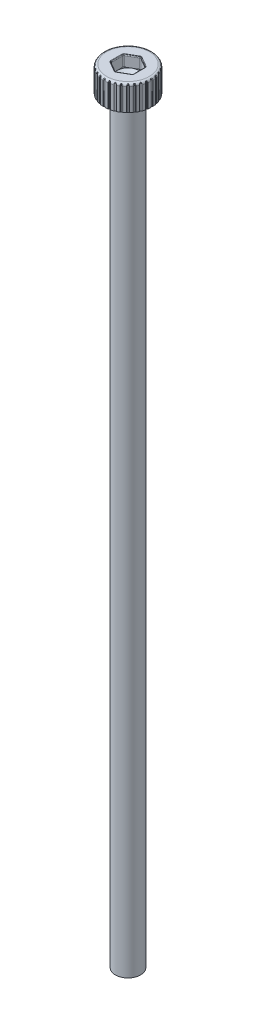
from build123d import *

# Parameters (mm, degrees)
SKETCH1_R                = 2.84
BOSS_EXTRUDE1_DEPTH      = 3
SKETCH2_R                = 1.5
BOSS_EXTRUDE2_DEPTH      = 90
CUT_EXTRUDE1_DEPTH       = 1.3
FILLET1_R                = 0.3
SKETCH5_R                = 0.075
CUT_EXTRUDE2_DEPTH       = 91.08957321
FILLET2_R                = 0.075
CIRPATTERN1_COUNT        = 32
FILLET2_OF_CIRPATTERN1_R = 0.075
CHAMFER1_SIZE            = 0.075
FILLET3_R                = 0.15
FILLET4_R                = 0.15
FILLET5_R                = 0.075


with BuildPart() as part:
    # Sketch1 → Boss-Extrude1 (new body)
    with BuildSketch(Plane(origin=(0, 0, 0), x_dir=(1, 0, 0), z_dir=(0, 1, 0))):
        Circle(SKETCH1_R)
    extrude(amount=BOSS_EXTRUDE1_DEPTH)

    # Sketch2 → Boss-Extrude2 (add)
    with BuildSketch(Plane.XZ):
        Circle(SKETCH2_R)
    extrude(amount=BOSS_EXTRUDE2_DEPTH)

    # Sketch3 → Cut-Extrude1 (cut)
    with BuildSketch(Plane(origin=(0, 3, 0), x_dir=(1, 0, 0), z_dir=(0, 1, 0))):
        Polygon((1.29, 0.744781847), (0, 1.489563695), (-1.29, 0.744781847), (-1.29, -0.744781847), (0, -1.489563695), (1.29, -0.744781847), align=None)
    extrude(amount=-CUT_EXTRUDE1_DEPTH, mode=Mode.SUBTRACT)

    # Sketch4 → Cut-Revolve1 (revolve, cut)
    with BuildSketch(Plane.XY):
        Polygon((0, 1.7), (0, 0.955218153), (1.29, 1.7), align=None)
    revolve(axis=Axis((0, 0.955218153, 0), (0, -1, 0)), mode=Mode.SUBTRACT)

    # Fillet1
    fillet1_edges = [part.edges().sort_by_distance(p)[0] for p in [
        (-2.84, 3, 0),
    ]]
    fillet(fillet1_edges, radius=FILLET1_R)

    # Sketch5 → Cut-Extrude2 (cut, through all)
    with BuildSketch(Plane.XZ):
        with Locations((0, 2.84)):
            Circle(SKETCH5_R)
    cut_extrude2 = extrude(amount=-CUT_EXTRUDE2_DEPTH, mode=Mode.SUBTRACT)

    # Fillet2
    fillet2_edges = [part.edges().sort_by_distance(p)[0] for p in [
        (0.074993462, 1.35, 2.839009683),
        (0, 2.898431349, 2.764999999),
        (-0.074993462, 1.35, 2.839009683),
    ]]
    fillet(fillet2_edges, radius=FILLET2_R)

    # CirPattern1: Cut-Extrude2 ×32 about axis
    cirpattern1_axis = Axis((0, 3, 0), (0, -1, 0))
    for i in range(1, CIRPATTERN1_COUNT):
        add(cut_extrude2.rotate(cirpattern1_axis, i * 360 / CIRPATTERN1_COUNT), mode=Mode.SUBTRACT)

    # Fillet2 of CirPattern1
    fillet2_of_cirpattern1_edges = [part.edges().sort_by_distance(p)[0] for p in [
        (-0.48031083, 1.35, 2.799089407),
        (-0.53942474, 2.898431349, 2.7118713),
        (-0.627415796, 1.35, 2.76982841),
        (-1.017157046, 1.35, 2.651601694),
        (-1.05811969, 2.898431349, 2.554526907),
        (-1.155726894, 1.35, 2.594204184),
        (-1.514914487, 1.35, 2.402214415),
        (-1.536151694, 2.898431349, 2.299013477),
        (-1.639624056, 1.35, 2.318886146),
        (-1.954454614, 1.35, 2.060511384),
        (-1.955150249, 2.898431349, 1.95515025),
        (-2.060511384, 1.35, 1.954454614),
        (-2.318886146, 1.35, 1.639624056),
        (-2.299013477, 2.898431349, 1.536151694),
        (-2.402214415, 1.35, 1.514914487),
        (-2.594204184, 1.35, 1.155726894),
        (-2.554526907, 2.898431349, 1.05811969),
        (-2.651601694, 1.35, 1.017157046),
        (-2.76982841, 1.35, 0.627415796),
        (-2.7118713, 2.898431349, 0.53942474),
        (-2.799089407, 1.35, 0.48031083),
        (-2.839009683, 1.35, 0.074993462),
        (-2.764999999, 2.898431349, 0),
        (-2.839009683, 1.35, -0.074993462),
        (-2.799089407, 1.35, -0.48031083),
        (-2.7118713, 2.898431349, -0.53942474),
        (-2.76982841, 1.35, -0.627415796),
        (-2.651601694, 1.35, -1.017157046),
        (-2.554526907, 2.898431349, -1.05811969),
        (-2.594204184, 1.35, -1.155726894),
        (-2.402214415, 1.35, -1.514914487),
        (-2.299013477, 2.898431349, -1.536151694),
        (-2.318886146, 1.35, -1.639624056),
        (-2.060511384, 1.35, -1.954454614),
        (-1.95515025, 2.898431349, -1.955150249),
        (-1.954454614, 1.35, -2.060511384),
        (-1.639624056, 1.35, -2.318886146),
        (-1.536151694, 2.898431349, -2.299013477),
        (-1.514914487, 1.35, -2.402214415),
        (-1.155726894, 1.35, -2.594204184),
        (-1.05811969, 2.898431349, -2.554526907),
        (-1.017157046, 1.35, -2.651601694),
        (-0.627415796, 1.35, -2.76982841),
        (-0.53942474, 2.898431349, -2.7118713),
        (-0.48031083, 1.35, -2.799089407),
        (-0.074993462, 1.35, -2.839009683),
        (0, 2.898431349, -2.764999999),
        (0.074993462, 1.35, -2.839009683),
        (0.48031083, 1.35, -2.799089407),
        (0.53942474, 2.898431349, -2.7118713),
        (0.627415796, 1.35, -2.76982841),
        (1.017157046, 1.35, -2.651601694),
        (1.05811969, 2.898431349, -2.554526907),
        (1.155726894, 1.35, -2.594204184),
        (1.514914487, 1.35, -2.402214415),
        (1.536151694, 2.898431349, -2.299013477),
        (1.639624056, 1.35, -2.318886146),
        (1.954454614, 1.35, -2.060511384),
        (1.955150249, 2.898431349, -1.95515025),
        (2.060511384, 1.35, -1.954454614),
        (2.318886146, 1.35, -1.639624056),
        (2.299013477, 2.898431349, -1.536151694),
        (2.402214415, 1.35, -1.514914487),
        (2.594204184, 1.35, -1.155726894),
        (2.554526907, 2.898431349, -1.05811969),
        (2.651601694, 1.35, -1.017157046),
        (2.76982841, 1.35, -0.627415796),
        (2.7118713, 2.898431349, -0.53942474),
        (2.799089407, 1.35, -0.48031083),
        (2.839009683, 1.35, -0.074993462),
        (2.764999999, 2.898431349, 0),
        (2.839009683, 1.35, 0.074993462),
        (2.799089407, 1.35, 0.48031083),
        (2.7118713, 2.898431349, 0.53942474),
        (2.76982841, 1.35, 0.627415796),
        (2.651601694, 1.35, 1.017157046),
        (2.554526907, 2.898431349, 1.05811969),
        (2.594204184, 1.35, 1.155726894),
        (2.402214415, 1.35, 1.514914487),
        (2.299013477, 2.898431349, 1.536151694),
        (2.318886146, 1.35, 1.639624056),
        (2.060511384, 1.35, 1.954454614),
        (1.95515025, 2.898431349, 1.955150249),
        (1.954454614, 1.35, 2.060511384),
        (1.639624056, 1.35, 2.318886146),
        (1.536151694, 2.898431349, 2.299013477),
        (1.514914487, 1.35, 2.402214415),
        (1.155726894, 1.35, 2.594204184),
        (1.05811969, 2.898431349, 2.554526907),
        (1.017157046, 1.35, 2.651601694),
        (0.627415796, 1.35, 2.76982841),
        (0.53942474, 2.898431349, 2.7118713),
        (0.48031083, 1.35, 2.799089407),
    ]]
    fillet(fillet2_of_cirpattern1_edges, radius=FILLET2_OF_CIRPATTERN1_R)

    # Chamfer1
    chamfer1_edges = [part.edges().sort_by_distance(p)[0] for p in [
        (0.645, 3, -1.117172771),
        (1.29, 3, 0),
        (0.645, 3, 1.117172771),
        (-0.645, 3, 1.117172771),
        (-1.29, 3, 0),
        (-0.645, 3, -1.117172771),
    ]]
    chamfer(chamfer1_edges, length=CHAMFER1_SIZE)

    # Fillet3
    fillet3_edges = [part.edges().sort_by_distance(p)[0] for p in [
        (-0.645, 2.925, -1.117172771),
        (0.645, 2.925, -1.117172771),
        (1.29, 2.925, 0),
        (-1.29, 2.925, 0),
        (-0.645, 2.925, 1.117172771),
        (0.645, 2.925, 1.117172771),
    ]]
    fillet(fillet3_edges, radius=FILLET3_R)

    # Fillet4
    fillet4_edges = [part.edges().sort_by_distance(p)[0] for p in [
        (1.29, 2.281433983, -0.744781847),
        (1.349466991, 2.984466991, -0.779115131),
        (0, 2.281433983, -1.489563695),
        (0, 2.984466991, -1.558230262),
        (-1.349466991, 2.984466991, -0.779115131),
        (-1.29, 2.281433983, -0.744781847),
        (-1.349466991, 2.984466991, 0.779115131),
        (-1.29, 2.281433983, 0.744781847),
        (0, 2.984466991, 1.558230262),
        (0, 2.281433983, 1.489563695),
        (1.29, 2.281433983, 0.744781847),
        (1.349466991, 2.984466991, 0.779115131),
        (1.301891124, 2.921399482, -0.751647191),
        (0, 2.921399482, -1.503294382),
        (-1.301891124, 2.921399482, -0.751647191),
        (-1.301891124, 2.921399482, 0.751647191),
        (0, 2.921399482, 1.503294382),
        (1.301891124, 2.921399482, 0.751647191),
    ]]
    fillet(fillet4_edges, radius=FILLET4_R)

    # Fillet5
    fillet5_edges = [part.edges().sort_by_distance(p)[0] for p in [
        (-1.351299314, 3, 0.780173023),
        (-0.6825, 3, 1.182124676),
        (0, 3, 1.560346045),
        (0.6825, 3, 1.182124676),
        (1.351299314, 3, 0.780173023),
        (1.365, 3, 0),
        (1.351299314, 3, -0.780173023),
        (0.6825, 3, -1.182124676),
        (0, 3, -1.560346045),
        (-0.6825, 3, -1.182124676),
        (-1.351299314, 3, -0.780173023),
        (-1.365, 3, 0),
    ]]
    fillet(fillet5_edges, radius=FILLET5_R)


solid = part.part
